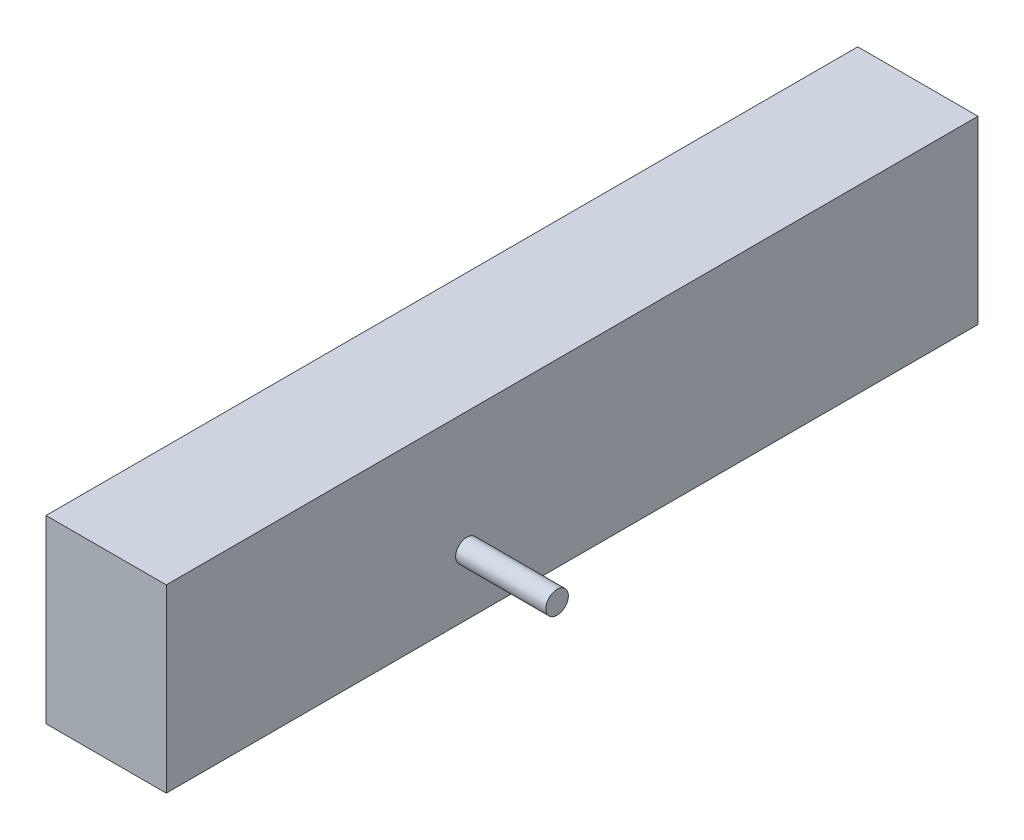
from build123d import *

# Parameters (mm, degrees)
SKETCH1_R           = 9.525
BOSS_EXTRUDE1_DEPTH = 127
SKETCH2_W           = 685.8
SKETCH2_H           = 152.4
BOSS_EXTRUDE2_DEPTH = 50.8


with BuildPart() as part:
    # Sketch1 → Boss-Extrude1 (new, symmetric)
    with BuildSketch(Plane(origin=(0, 0, 0), x_dir=(0, 0, -1), z_dir=(1, 0, 0))):
        Circle(SKETCH1_R)
    extrude(amount=BOSS_EXTRUDE1_DEPTH, both=True)

    # Sketch2 → Boss-Extrude2 (add, symmetric)
    with BuildSketch(Plane(origin=(0, 0, 0), x_dir=(0, 0, -1), z_dir=(1, 0, 0))):
        with Locations((88.9, 25.4)):
            Rectangle(SKETCH2_W, SKETCH2_H)
    extrude(amount=BOSS_EXTRUDE2_DEPTH, both=True)


solid = part.part
